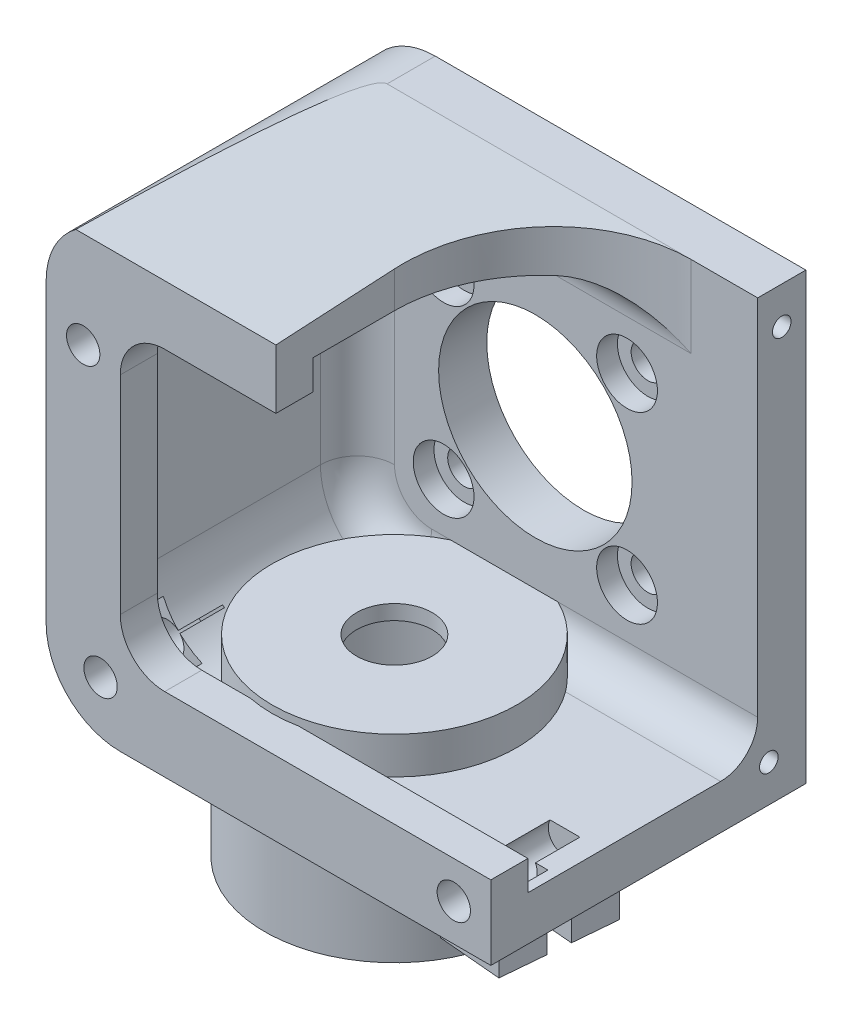
from build123d import *

# Parameters (mm, degrees)
SCHIZZO1_W                   = 60
SCHIZZO1_H                   = 60
SCHIZZO1_R                   = 13.05
SCHIZZO1_R_2                 = 2.25
ESTRUSIONE_ESTRUSIONE1_DEPTH = 6.5
ESTRUSIONE_ESTRUSIONE2_DEPTH = 36
TAGLIO_ESTRUSIONE4_DEPTH     = 61.557823607
RACCORDO2_R                  = 20
RACCORDO1_R                  = 10
ESTRUSIONE_ESTRUSIONE3_START = -5
ESTRUSIONE_ESTRUSIONE3_DEPTH = 5
SCHIZZO5_R                   = 4.1
TAGLIO_ESTRUSIONE1_DEPTH     = 2.8
SCHIZZO6_R                   = 2.25
TAGLIO_ESTRUSIONE2_DEPTH     = 15
TAGLIO_ESTRUSIONE3_DEPTH     = 4
RACCORDO3_R                  = 5
SCHIZZO9_R                   = 1.25
TAGLIO_ESTRUSIONE5_DEPTH     = 10
SCHIZZO10_R                  = 5.1
TAGLIO_ESTRUSIONE6_DEPTH     = 75.981664497
SCHIZZO11_R                  = 16.5
ESTRUSIONE_ESTRUSIONE4_DEPTH = 5
TAGLIO_ESTRUSIONE8_REACH     = 76.982
SCHIZZO12_R                  = 5.1
SCHIZZO13_R                  = 14.5
TAGLIO_ESTRUSIONE9_DEPTH     = 9
ESTRUSIONE_ESTRUSIONE5_START = 15
ESTRUSIONE_ESTRUSIONE5_DEPTH = 15
ESTRUSIONE_ESTRUSIONE6_DEPTH = 7.5
TAGLIO_ESTRUSIONE10_DEPTH    = 10
TAGLIO_ESTRUSIONE11_DEPTH    = 1.4
SCHIZZO19_R                  = 2.85
TAGLIO_ESTRUSIONE12_DEPTH    = 1


# Read off the part's stored shape, not the designer's step: Taglio-Estrusione3
with BuildPart() as part:
    # Schizzo1 → Estrusione-Estrusione1 (new body)
    with BuildSketch(Plane.XY):
        Rectangle(SCHIZZO1_W, SCHIZZO1_H)
        with Locations(Location((0, 0, 0), (0, 0, 180))):
            Circle(SCHIZZO1_R, mode=Mode.SUBTRACT)
        with Locations(Location((-12.374368671, 12.374368671, 0), (0, 0, 180))):
            Circle(SCHIZZO1_R_2, mode=Mode.SUBTRACT)
        with Locations(Location((12.374368671, 12.374368671, 0), (0, 0, 180))):
            Circle(SCHIZZO1_R_2, mode=Mode.SUBTRACT)
        with Locations(Location((12.374368671, -12.374368671, 0), (0, 0, 180))):
            Circle(SCHIZZO1_R_2, mode=Mode.SUBTRACT)
        with Locations(Location((-12.374368671, -12.374368671, 0), (0, 0, 180))):
            Circle(SCHIZZO1_R_2, mode=Mode.SUBTRACT)
    extrude(amount=ESTRUSIONE_ESTRUSIONE1_DEPTH)

    # Schizzo3 → Estrusione-Estrusione2 (add)
    with BuildSketch(Plane.XY.offset(6.5)):
        Polygon((30, -24), (-24, -24), (-24, 24), (1, 24), (1, 30), (-30, 30), (-30, -30), (30, -30), align=None)
    extrude(amount=ESTRUSIONE_ESTRUSIONE2_DEPTH)

    # Schizzo8 → Taglio-Estrusione4 (cut, through all)
    with BuildSketch(Plane(origin=(1, 0, 0), x_dir=(0, 0, -1), z_dir=(1, 0, 0))):
        Polygon((-42.5, 28), (-6.5, 30), (-42.5, 30), align=None)
    extrude(amount=-TAGLIO_ESTRUSIONE4_DEPTH, mode=Mode.SUBTRACT)

    # Raccordo2
    raccordo2_edges = [part.edges().sort_by_distance(p)[0] for p in [
        (1, 27, 6.5),
    ]]
    fillet(raccordo2_edges, radius=RACCORDO2_R)

    # Raccordo1
    # the kernel refuses this fillet: 10 mm, written as the material it adds along each edge
    with BuildSketch(Plane(origin=(-24, 24, 6.5), x_dir=(1, 0, 0), z_dir=(0, 0, 1)), Plane(origin=(-24, -24, 6.5), x_dir=(0, 1, 0), z_dir=(0, 0, 1))) as raccordo1_piece_1:
        with BuildLine():
            CenterArc((RACCORDO1_R, -RACCORDO1_R), RACCORDO1_R, 90, 90)
            Line((0, -RACCORDO1_R), (-RACCORDO1_R * 0.02, -RACCORDO1_R))
            Line((-RACCORDO1_R * 0.02, -RACCORDO1_R), (-RACCORDO1_R * 0.02, RACCORDO1_R * 0.02))
            Line((-RACCORDO1_R * 0.02, RACCORDO1_R * 0.02), (RACCORDO1_R, RACCORDO1_R * 0.02))
            Line((RACCORDO1_R, RACCORDO1_R * 0.02), (RACCORDO1_R, 0))
        make_face()
    extrude(amount=36)
    # the kernel refuses this fillet: 10 mm, written as the material it takes off along each edge
    with BuildSketch(Plane(origin=(-30, -30, 102.5), x_dir=(0, 1, 0), z_dir=(0, 0, -1))) as raccordo1_2_piece_1:
        with BuildLine():
            CenterArc((RACCORDO1_R, RACCORDO1_R), RACCORDO1_R, 180, 90)
            Line((0, RACCORDO1_R), (-RACCORDO1_R * 0.02, RACCORDO1_R))
            Line((-RACCORDO1_R * 0.02, RACCORDO1_R), (-RACCORDO1_R * 0.02, -RACCORDO1_R * 0.02))
            Line((-RACCORDO1_R * 0.02, -RACCORDO1_R * 0.02), (RACCORDO1_R, -RACCORDO1_R * 0.02))
            Line((RACCORDO1_R, -RACCORDO1_R * 0.02), (RACCORDO1_R, 0))
        make_face()
    extrude(amount=162.5, mode=Mode.SUBTRACT)
    with BuildSketch(Plane(origin=(-30, 30, 66.5), x_dir=(1, 0, 0), z_dir=(0, 0, -1))) as raccordo1_2_piece_2:
        with BuildLine():
            CenterArc((RACCORDO1_R, RACCORDO1_R), RACCORDO1_R, 180, 90)
            Line((0, RACCORDO1_R), (-RACCORDO1_R * 0.02, RACCORDO1_R))
            Line((-RACCORDO1_R * 0.02, RACCORDO1_R), (-RACCORDO1_R * 0.02, -RACCORDO1_R * 0.02))
            Line((-RACCORDO1_R * 0.02, -RACCORDO1_R * 0.02), (RACCORDO1_R, -RACCORDO1_R * 0.02))
            Line((RACCORDO1_R, -RACCORDO1_R * 0.02), (RACCORDO1_R, 0))
        make_face()
    extrude(amount=126.5, mode=Mode.SUBTRACT)

    # Schizzo4 → Estrusione-Estrusione3 (add)
    with BuildSketch(Plane.XY.offset(42.5).offset(ESTRUSIONE_ESTRUSIONE3_START)):
        with BuildLine():
            Line((-14, -24), (30, -24))
            Line((30, -24), (30, -20))
            Line((30, -20), (-14, -20))
            ThreePointArc((-14, -20), (-18.242640687, -18.242640687), (-20, -14))
            Line((-20, -14), (-20, 14))
            ThreePointArc((-20, 14), (-18.242640687, 18.242640687), (-14, 20))
            Line((-14, 20), (1, 20))
            Line((1, 20), (1, 24))
            Line((1, 24), (-14, 24))
            ThreePointArc((-14, 24), (-21.071067812, 21.071067812), (-24, 14))
            Line((-24, 14), (-24, -14))
            ThreePointArc((-24, -14), (-21.071067812, -21.071067812), (-14, -24))
        make_face()
    extrude(amount=ESTRUSIONE_ESTRUSIONE3_DEPTH)

    # Schizzo5 → Taglio-Estrusione1 (cut)
    with BuildSketch(Plane.XY.offset(6.5)):
        with Locations((12.374368671, 12.374368671)):
            Circle(SCHIZZO5_R)
        with Locations((-12.374368671, 12.374368671)):
            Circle(SCHIZZO5_R)
        with Locations((12.374368671, -12.374368671)):
            Circle(SCHIZZO5_R)
        with Locations((-12.374368671, -12.374368671)):
            Circle(SCHIZZO5_R)
    extrude(amount=-TAGLIO_ESTRUSIONE1_DEPTH, mode=Mode.SUBTRACT)

    # Schizzo6 → Taglio-Estrusione2 (cut)
    with BuildSketch(Plane.XY.offset(42.5)):
        with Locations((25, -25)):
            Circle(SCHIZZO6_R)
        with Locations((-22.656854249, -22.656854249)):
            Circle(SCHIZZO6_R)
        with Locations((-25, 15)):
            Circle(SCHIZZO6_R)
    extrude(amount=-TAGLIO_ESTRUSIONE2_DEPTH, mode=Mode.SUBTRACT)

    # Taglio-Estrusione3 outline → Taglio-Estrusione3 (cut)
    with BuildSketch(Plane(origin=(0, 0, 37.5), x_dir=(-1, 0, 0), z_dir=(0, 0, -1))):
        with BuildLine():
            Line((-21.3, -27.136195996), (-21.3, -24))
            Line((-21.3, -24), (-22.984435563, -24))
            ThreePointArc((-22.984435563, -24), (-25, -27.25), (-27.015564437, -24))
            Line((-27.015564437, -24), (-28.7, -24))
            Line((-28.7, -24), (-28.7, -27.136195996))
            Line((-28.7, -27.136195996), (-25, -29.272391992))
            Line((-25, -29.272391992), (-21.3, -27.136195996))
        make_face()
        with BuildLine():
            Line((26.783668015, -21.551077834), (23.185541623, -17.952951442))
            ThreePointArc((23.185541623, -17.952951442), (22.322309871, -19.544290615), (21.186311964, -20.953914031))
            ThreePointArc((21.186311964, -20.953914031), (24.247844507, -24.247844507), (20.953914031, -21.186311964))
            ThreePointArc((20.953914031, -21.186311964), (19.544290615, -22.322309871), (17.952951442, -23.185541623))
            Line((17.952951442, -23.185541623), (21.551077834, -26.783668015))
            Line((21.551077834, -26.783668015), (25.677891599, -25.677891599))
            Line((25.677891599, -25.677891599), (26.783668015, -21.551077834))
        make_face()
        with BuildLine():
            Line((22.863804004, 18.7), (22.844440795, 18.666461938))
            ThreePointArc((22.844440795, 18.666461938), (23.275441819, 17.737135141), (23.609105412, 16.768590468))
            ThreePointArc((23.609105412, 16.768590468), (27.238090999, 15.231189706), (24, 12.984435563))
            Line((24, 12.984435563), (24, 11.3))
            Line((24, 11.3), (27.136195996, 11.3))
            Line((27.136195996, 11.3), (29.272391992, 15))
            Line((29.272391992, 15), (27.136195996, 18.7))
            Line((27.136195996, 18.7), (22.863804004, 18.7))
        make_face()
    extrude(amount=TAGLIO_ESTRUSIONE3_DEPTH, mode=Mode.SUBTRACT)

    # Raccordo3
    raccordo3_edges = [part.edges().sort_by_distance(p)[0] for p in [
        (3.5, 24, 6.5),
        (-24, 0, 6.5),
        (8, -24, 6.5),
        (-21.071067812, -21.071067812, 6.5),
        (-21.071067812, 21.071067812, 6.5),
    ]]
    fillet(raccordo3_edges, radius=RACCORDO3_R)

    # Schizzo9 → Taglio-Estrusione5 (cut)
    with BuildSketch(Plane(origin=(30, 0, 0), x_dir=(0, 0, -1), z_dir=(1, 0, 0))):
        with Locations((-3.25, 25)):
            Circle(SCHIZZO9_R)
        with Locations((-5, -25)):
            Circle(SCHIZZO9_R)
    extrude(amount=-TAGLIO_ESTRUSIONE5_DEPTH, mode=Mode.SUBTRACT)

    # Schizzo10 → Taglio-Estrusione6 (cut, through all)
    with BuildSketch(Plane(origin=(0, -24, 0), x_dir=(1, 0, 0), z_dir=(0, 1, 0))):
        with Locations(Location((-4.189233611, -21.321452148, 0), (0, 0, 180))):
            Circle(SCHIZZO10_R)
    extrude(amount=-TAGLIO_ESTRUSIONE6_DEPTH, mode=Mode.SUBTRACT)

    # Schizzo11 → Estrusione-Estrusione4 (add)
    with BuildSketch(Plane(origin=(0, -24, 0), x_dir=(1, 0, 0), z_dir=(0, 1, 0))):
        with Locations((-4.189233611, -21.321452148)):
            Circle(SCHIZZO11_R)
    extrude(amount=ESTRUSIONE_ESTRUSIONE4_DEPTH)

    # Schizzo12 → Taglio-Estrusione8 (cut, up to next)
    with BuildSketch(Plane.XZ.offset(24), mode=Mode.PRIVATE) as taglio_estrusione8_sk1:
        with Locations(Location((-4.189233611, 21.321452148, 0), (0, 0, 180))):
            Circle(SCHIZZO12_R)
    taglio_estrusione8_tool1 = extrude(taglio_estrusione8_sk1.sketch, amount=-TAGLIO_ESTRUSIONE8_REACH, mode=Mode.PRIVATE) & part.part
    add(taglio_estrusione8_tool1.solids().sort_by_distance((-4.189234, -24, 21.321452))[0], mode=Mode.SUBTRACT)

    # Schizzo13 → Taglio-Estrusione9 (cut)
    with BuildSketch(Plane.XZ.offset(30)):
        with Locations((-4.189233611, 21.321452148)):
            Circle(SCHIZZO13_R)
    extrude(amount=-TAGLIO_ESTRUSIONE9_DEPTH, mode=Mode.SUBTRACT)

    # Schizzo14 → Estrusione-Estrusione5 (add)
    with BuildSketch(Plane.XZ.offset(30).offset(ESTRUSIONE_ESTRUSIONE5_START)):
        with BuildLine():
            ThreePointArc((10.310766389, 21.321452148), (-18.634056733, 20.057693878), (10.090478808, 23.839350724))
            Line((10.090478808, 23.839350724), (13.044902067, 24.360295257))
            ThreePointArc((13.044902067, 24.360295257), (-1.847247301, 38.664032698), (-20, 28.822763113))
            Line((-20, 28.822763113), (-20, 13.820141183))
            ThreePointArc((-20, 13.820141183), (-0.344653777, 4.248982909), (13.310766389, 21.321452148))
            Line((13.310766389, 21.321452148), (10.310766389, 21.321452148))
        make_face()
    extrude(amount=-ESTRUSIONE_ESTRUSIONE5_DEPTH)

    # Schizzo16 → Estrusione-Estrusione6 (add, symmetric)
    with BuildSketch(Plane(origin=(-1.883037591, 0, 21.523218155), x_dir=(-0.9961946980917455, 0, -0.08715574274765853), z_dir=(-0.08715574274765853, 0, 0.9961946980917455))):
        with BuildLine():
            Line((-15.118401903, 32.5), (-15.118401903, 35.488584094))
            Line((-15.118401903, 35.488584094), (-15.892380941, 36.262563133))
            ThreePointArc((-15.892380941, 36.262563133), (-18.367254675, 36.262563133), (-18.367254675, 38.737436867))
            Line((-18.367254675, 38.737436867), (-22.129817808, 42.5))
            Line((-22.129817808, 42.5), (-22.129817808, 32.5))
            Line((-22.129817808, 32.5), (-15.118401903, 32.5))
        make_face()
        with BuildLine():
            Line((-15.118401903, 35.488584094), (-15.118401903, 42.5))
            Line((-15.118401903, 42.5), (-22.129817808, 42.5))
            Line((-22.129817808, 42.5), (-18.367254675, 38.737436867))
            ThreePointArc((-18.367254675, 38.737436867), (-16.460121802, 39.116789182), (-15.379817808, 37.5))
            ThreePointArc((-15.379817808, 37.5), (-15.513028626, 36.830303993), (-15.892380941, 36.262563133))
            Line((-15.892380941, 36.262563133), (-15.118401903, 35.488584094))
        make_face()
        Polygon((-12.129817808, 42.5), (-15.118401903, 42.5), (-15.118401903, 35.488584094), (-12.129817808, 32.5), align=None)
        Polygon((-12.129817808, 32.5), (-15.118401903, 35.488584094), (-15.118401903, 32.5), align=None)
    extrude(amount=ESTRUSIONE_ESTRUSIONE6_DEPTH, both=True)

    # Schizzo17 → Taglio-Estrusione10 (cut)
    with BuildSketch(Plane.XZ.offset(42.5)):
        Polygon((10.090478808, 23.839350724), (10.310766389, 21.321452148), (13.310766389, 21.321452148), (20.29550174, 21.932537309), (20.029637418, 24.971380418), (13.044902067, 24.360295257), align=None)
    extrude(amount=-TAGLIO_ESTRUSIONE10_DEPTH, mode=Mode.SUBTRACT)

    # Schizzo18 → Taglio-Estrusione11 (cut)
    with BuildSketch(Plane(origin=(-1.229369521, 0, 14.05175792), x_dir=(-0.9961946980917455, 0, -0.08715574274765861), z_dir=(0.0871557427476586, 0, -0.9961946980917454))):
        Polygon((-19.979817808, -35.854551733), (-19.979817808, -39.145448267), (-17.129817808, -40.790896534), (-14.279817808, -39.145448267), (-14.279817808, -35.854551733), (-17.129817808, -34.209103466), align=None)
    extrude(amount=-TAGLIO_ESTRUSIONE11_DEPTH, mode=Mode.SUBTRACT)

    # Schizzo19 → Taglio-Estrusione12 (cut)
    with BuildSketch(Plane(origin=(-2.536705662, 0, 28.994678391), x_dir=(0.9961946980917455, 0, 0.08715574274765861), z_dir=(-0.0871557427476586, 0, 0.9961946980917454))):
        with Locations((17.129817808, -37.5)):
            Circle(SCHIZZO19_R)
    extrude(amount=-TAGLIO_ESTRUSIONE12_DEPTH, mode=Mode.SUBTRACT)


solid = part.part
